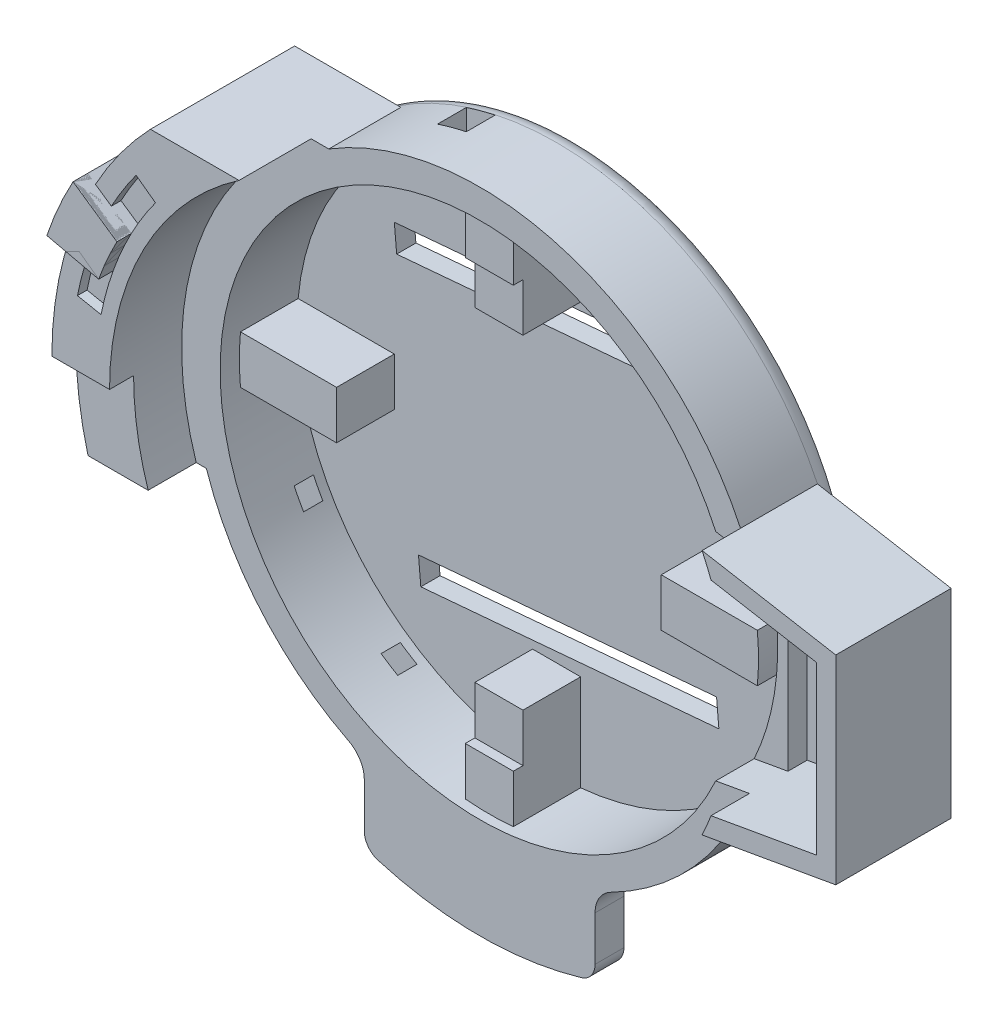
from build123d import *

# Parameters (mm, degrees)
SKETCH_1_R           = 30
EXTRUDE_1_DEPTH      = 2
SKETCH_5_R           = 30
SKETCH_5_R_2         = 27
EXTRUDE_2_DEPTH      = 10
EXTRUDE_START        = -3
EXTRUDE_3_DEPTH      = 3
FILLET_2_R           = 3
FILLET_3_R           = 3
EXTRUDE_START_2      = -6
EXTRUDE_4_DEPTH      = 6
EXTRUDE_6_DEPTH      = 7.5
SKETCH_14_R          = 31
CUT_EXTRUDE_3_DEPTH  = 7.5
CHAMFER_4_SIZE       = 2.644904711
CHAMFER_4_SIZE_2     = 15
CHAMFER_5_SIZE       = 2.644904711
CHAMFER_5_SIZE_2     = 15
CUT_EXTRUDE_START    = -4
CUT_EXTRUDE_6_DEPTH  = 4
EXTRUDE_10_DEPTH     = 5
CUT_EXTRUDE_START_2  = 6
CUT_EXTRUDE_7_DEPTH  = 6
EXTRUDE_11_DEPTH     = 8
EXTRUDE_12_DEPTH     = 1
EXTRUDE_13_DEPTH     = 1.5
EXTRUDE_14_DEPTH     = 16.5
CUT_EXTRUDE_START_3  = -1
CUT_EXTRUDE_8_DEPTH  = 1
EXTRUDE_START_3      = 2
EXTRUDE_15_DEPTH     = 2
CUT_EXTRUDE_9_DEPTH  = 2
SKETCH_33_R          = 30
CUT_EXTRUDE_10_DEPTH = 2
SKETCH_34_R          = 30
EXTRUDE_16_DEPTH     = 2
FILLET_4_R           = 2
FILLET_5_R           = 2
CUT_EXTRUDE_11_DEPTH = 10
FILLET_6_R           = 2
SKETCH_37_W          = 2
SKETCH_37_H          = 2
CUT_EXTRUDE_12_DEPTH = 65
SKETCH_38_W          = 3
SKETCH_38_H          = 3
CUT_EXTRUDE_14_DEPTH = 45
EXTRUDE_17_DEPTH     = 4


# Some blends are built 0.0001 mm under size
with BuildPart() as part:
    # 草图1 → 凸台-拉伸1 (new body)
    with BuildSketch(Plane.XY):
        Circle(SKETCH_1_R)
    extrude(amount=EXTRUDE_1_DEPTH)

    # 草图5 → 凸台-拉伸2 (add)
    with BuildSketch(Plane.XY.offset(2)):
        Circle(SKETCH_5_R)
        Circle(SKETCH_5_R_2, mode=Mode.SUBTRACT)
    extrude(amount=EXTRUDE_2_DEPTH)

    # 草图6 → 凸台-拉伸3 (add)
    with BuildSketch(Plane.XY.offset(12).offset(EXTRUDE_START)):
        with BuildLine():
            Line((-12, -27.49545417), (-12, -35.49545417))
            ThreePointArc((-12, -35.49545417), (0, -37.469017424), (12, -35.49545417))
            Line((12, -35.49545417), (12, -27.49545417))
            ThreePointArc((12, -27.49545417), (0, -30), (-12, -27.49545417))
        make_face()
    extrude(amount=EXTRUDE_3_DEPTH)

    # 圆角2
    fillet_2_edges = [part.edges().sort_by_distance(p)[0] for p in [
        (-12, -27.49545417, 10.5),
    ]]
    fillet(fillet_2_edges, radius=FILLET_2_R)

    # 圆角3
    fillet_3_edges = [part.edges().sort_by_distance(p)[0] for p in [
        (12, -27.49545417, 10.5),
    ]]
    fillet(fillet_3_edges, radius=FILLET_3_R)

    # 草图8 → 凸台-拉伸4 (add)
    with BuildSketch(Plane.XY.offset(12).offset(EXTRUDE_START_2)):
        with BuildLine():
            Line((27.037011669, -13), (41.037011669, -13))
            Line((41.037011669, -13), (41.037011669, 13))
            Line((41.037011669, 13), (27.037011669, 13))
            ThreePointArc((27.037011669, 13), (30, 0), (27.037011669, -13))
        make_face()
    extrude(amount=EXTRUDE_4_DEPTH)

    # 草图13 → 凸台-拉伸6 (add, symmetric)
    with BuildSketch(Plane.XY.offset(12)):
        with BuildLine():
            Line((-26.746575291, 25.566006927), (-15.696473801, 25.566006927))
            ThreePointArc((-15.696473801, 25.566006927), (-26.181044804, 14.647624141), (-30, 0))
            Line((-30, 0), (-37, 0))
            ThreePointArc((-37, 0), (-34.341107188, 13.772739637), (-26.746575291, 25.566006927))
        make_face()
    extrude(amount=EXTRUDE_6_DEPTH, both=True)

    # 草图14 → 切除-拉伸3 (cut)
    with BuildSketch(Plane.XY.offset(19.5)):
        Circle(SKETCH_14_R)
    extrude(amount=-CUT_EXTRUDE_3_DEPTH, mode=Mode.SUBTRACT)

    # 倒角4
    # the kernel refuses this chamfer: 15, 2.644904711 mm, written as the material it takes off along each edge
    with BuildSketch(Plane(origin=(41.037011669, 13, -32.978081946), x_dir=(0.21013876076743002, -0.9776715712462589, 0), z_dir=(0, 0, 1))) as chamfer_4_piece_1_section:
        Polygon((CHAMFER_4_SIZE * 0.977671571108, -CHAMFER_4_SIZE * 0.210138760738), (-CHAMFER_4_SIZE_2 * 0.210138760767, -CHAMFER_4_SIZE_2 * 0.977671571246), (0, 0), align=None)
    chamfer_4_piece_1 = extrude(amount=83.956163893, mode=Mode.PRIVATE)
    chamfer_4_piece_1 = chamfer_4_piece_1 - Plane(origin=(0, 0, 9), x_dir=(1, 0, 0), z_dir=(0, 0, -1)) * Cylinder(30, 227, mode=Mode.PRIVATE)
    add(chamfer_4_piece_1, mode=Mode.SUBTRACT)

    # 倒角5
    # the kernel refuses this chamfer: 15, 2.644904711 mm, written as the material it takes off along each edge
    with BuildSketch(Plane(origin=(41.037011669, -13, -32.978081946), x_dir=(0.21013876076743015, 0.9776715712462588, 0), z_dir=(0, 0, 1))) as chamfer_5_piece_1_section:
        Polygon((CHAMFER_5_SIZE * 0.977671571108, CHAMFER_5_SIZE * 0.210138760738), (-CHAMFER_5_SIZE_2 * 0.210138760767, CHAMFER_5_SIZE_2 * 0.977671571246), (0, 0), align=None)
    chamfer_5_piece_1 = extrude(amount=83.956163893, mode=Mode.PRIVATE)
    chamfer_5_piece_1 = chamfer_5_piece_1 - Plane(origin=(0, 0, 9), x_dir=(1, 0, 0), z_dir=(0, 0, -1)) * Cylinder(30, 227, mode=Mode.PRIVATE)
    add(chamfer_5_piece_1, mode=Mode.SUBTRACT)

    # 草图16 → 切除-拉伸6 (cut)
    with BuildSketch(Plane.XY.offset(12).offset(CUT_EXTRUDE_START)):
        with BuildLine():
            ThreePointArc((27, 0), (26.381265258, 5.747072595), (24.553419007, 11.230744191))
            Line((24.553419007, 11.230744191), (18.452318659, 12.306532794))
            Line((18.452318659, 12.306532794), (21.994315515, -11.681983183))
            Line((21.994315515, -11.681983183), (24.553419007, -11.230744191))
            ThreePointArc((24.553419007, -11.230744191), (26.381265258, -5.747072595), (27, 0))
        make_face()
        with BuildLine():
            Line((18.452318659, 12.306532794), (24.553419007, 11.230744191))
            ThreePointArc((24.553419007, 11.230744191), (-27, 0), (24.553419007, -11.230744191))
            Line((24.553419007, -11.230744191), (21.994315515, -11.681983183))
            Line((21.994315515, -11.681983183), (18.452318659, 12.306532794))
        make_face()
        with BuildLine():
            Line((39.037011669, 8.676896027), (27.995789134, 10.62376146))
            Line((27.995789134, 10.62376146), (24.553419007, 11.230744191))
            ThreePointArc((24.553419007, 11.230744191), (26.381265258, 5.747072595), (27, 0))
            ThreePointArc((27, 0), (26.381265258, -5.747072595), (24.553419007, -11.230744191))
            Line((24.553419007, -11.230744191), (39.037011669, -8.676896027))
            Line((39.037011669, -8.676896027), (39.037011669, 8.676896027))
        make_face()
    extrude(amount=CUT_EXTRUDE_6_DEPTH, mode=Mode.SUBTRACT)

    # 草图17 → 凸台-拉伸10 (add, symmetric)
    with BuildSketch(Plane.XY.offset(12)):
        with BuildLine():
            Line((-28.430518618, -9.576304669), (-35.739255573, -9.576304669))
            ThreePointArc((-35.739255573, -9.576304669), (-36.683459871, -4.829469112), (-37, 0))
            Line((-37, 0), (-31, 0))
            Line((-31, 0), (-30, 0))
            ThreePointArc((-30, 0), (-29.605029628, -4.852032639), (-28.430518618, -9.576304669))
        make_face()
    extrude(amount=EXTRUDE_10_DEPTH, both=True)

    # 草图18 → 切除-拉伸7 (cut)
    with BuildSketch(Plane.XY.offset(12).offset(CUT_EXTRUDE_START_2)):
        with BuildLine():
            ThreePointArc((-31, 0), (-30.618603506, -4.847795306), (-29.483798753, -9.576304669))
            Line((-29.483798753, -9.576304669), (-28.430518618, -9.576304669))
            ThreePointArc((-28.430518618, -9.576304669), (-29.605029628, -4.852032639), (-30, 0))
            Line((-30, 0), (-31, 0))
        make_face()
    extrude(amount=-CUT_EXTRUDE_7_DEPTH, mode=Mode.SUBTRACT)

    # 草图19 → 凸台-拉伸11 (add)
    with BuildSketch(Plane.XY.offset(2)):
        with BuildLine():
            Line((-2.5, 26.884010118), (-2.5, 16.884010118))
            Line((-2.5, 16.884010118), (2.5, 16.884010118))
            Line((2.5, 16.884010118), (2.5, 26.884010118))
            ThreePointArc((2.5, 26.884010118), (0, 27), (-2.5, 26.884010118))
        make_face()
        with BuildLine():
            Line((26.884010118, 2.5), (16.884010118, 2.5))
            Line((16.884010118, 2.5), (16.884010118, -2.5))
            Line((16.884010118, -2.5), (26.884010118, -2.5))
            ThreePointArc((26.884010118, -2.5), (27, 0), (26.884010118, 2.5))
        make_face()
        with BuildLine():
            Line((2.5, -26.884010118), (2.5, -16.884010118))
            Line((2.5, -16.884010118), (-2.5, -16.884010118))
            Line((-2.5, -16.884010118), (-2.5, -26.884010118))
            ThreePointArc((-2.5, -26.884010118), (0, -27), (2.5, -26.884010118))
        make_face()
        with BuildLine():
            Line((-26.884010118, -2.5), (-16.884010118, -2.5))
            Line((-16.884010118, -2.5), (-16.884010118, 2.5))
            Line((-16.884010118, 2.5), (-26.884010118, 2.5))
            ThreePointArc((-26.884010118, 2.5), (-27, 0), (-26.884010118, -2.5))
        make_face()
    extrude(amount=EXTRUDE_11_DEPTH)

    # 草图20 → 凸台-拉伸12 (add)
    with BuildSketch(Plane.XY.offset(10)):
        with BuildLine():
            ThreePointArc((2.5, -26.884010118), (0, -27), (-2.5, -26.884010118))
            Line((-2.5, -26.884010118), (-2.5, -21.884010118))
            Line((-2.5, -21.884010118), (2.5, -21.884010118))
            Line((2.5, -21.884010118), (2.5, -26.884010118))
        make_face()
        with BuildLine():
            ThreePointArc((2.5, 26.884010118), (0, 27), (-2.5, 26.884010118))
            Line((-2.5, 26.884010118), (-2.5, 21.884010118))
            Line((-2.5, 21.884010118), (2.5, 21.884010118))
            Line((2.5, 21.884010118), (2.5, 26.884010118))
        make_face()
    extrude(amount=EXTRUDE_12_DEPTH)

    # 草图21 → 凸台-拉伸13 (add)
    with BuildSketch(Plane.XY.offset(19.5)):
        with BuildLine():
            Line((-28.734434843, 15.184935109), (-33.295866493, 18.31352709))
            ThreePointArc((-33.295866493, 18.31352709), (-34.796265088, 15.271540063), (-36.019428995, 12.10787904))
            Line((-36.019428995, 12.10787904), (-30.628781703, 10.868658214))
            ThreePointArc((-30.628781703, 10.868658214), (-29.759963562, 13.061185581), (-28.734434843, 15.184935109))
        make_face()
    extrude(amount=EXTRUDE_13_DEPTH)

    # 草图28 → 切除-拉伸8 (cut)
    with BuildSketch(Plane.XY.offset(19.5).offset(CUT_EXTRUDE_START_3)):
        with BuildLine():
            Line((-34.336052546, 6.784946244), (-31.883477364, 6.300307226))
            ThreePointArc((-31.883477364, 6.300307226), (-31.339481347, 8.60737526), (-30.628781703, 10.868658214))
            Line((-30.628781703, 10.868658214), (-33.080272788, 11.432215546))
            ThreePointArc((-33.080272788, 11.432215546), (-33.788156333, 9.130196691), (-34.336052546, 6.784946244))
        make_face()
        with BuildLine():
            ThreePointArc((-28.734434843, 15.184935109), (-27.551258788, 17.238855508), (-26.22152974, 19.201077524))
            Line((-26.22152974, 19.201077524), (-28.23857049, 20.678083487))
            ThreePointArc((-28.23857049, 20.678083487), (-29.593761465, 18.687142166), (-30.80882562, 16.607717))
            Line((-30.80882562, 16.607717), (-28.734434843, 15.184935109))
        make_face()
    extrude(amount=CUT_EXTRUDE_8_DEPTH, mode=Mode.SUBTRACT)

    # 草图31 → 凸台-拉伸15 (add)
    with BuildSketch(Plane(origin=(0, 0, 6), x_dir=(-1, 0, 0), z_dir=(0, 0, -1)).offset(EXTRUDE_START_3)):
        with BuildLine():
            Line((-41.037011669, 10.355095289), (-41.037011669, -10.355095289))
            Line((-41.037011669, -10.355095289), (-27.128728731, -12.807500827))
            ThreePointArc((-27.128728731, -12.807500827), (-30, 0), (-27.128728731, 12.807500827))
            Line((-27.128728731, 12.807500827), (-41.037011669, 10.355095289))
        make_face()
    extrude(amount=-EXTRUDE_15_DEPTH)

    # 草图32 → 切除-拉伸9 (cut)
    with BuildSketch(Plane.XY.offset(8)):
        Polygon((39.037011669, -8.676896027), (28.060239243, -10.612397167), (28.060239243, 10.612397167), (39.037011669, 8.676896027), align=None)
    extrude(amount=-CUT_EXTRUDE_9_DEPTH, mode=Mode.SUBTRACT)

    # 草图33 → 切除-拉伸10 (cut)
    with BuildSketch(Plane(origin=(0, 0, 0), x_dir=(-1, 0, 0), z_dir=(0, 0, -1))):
        Circle(SKETCH_33_R)
    extrude(amount=-CUT_EXTRUDE_10_DEPTH, mode=Mode.SUBTRACT)

    # 草图34 → 凸台-拉伸16 (add)
    with BuildSketch(Plane(origin=(0, 0, 2), x_dir=(-1, 0, 0), z_dir=(0, 0, -1))):
        Circle(SKETCH_34_R)
    extrude(amount=-EXTRUDE_16_DEPTH)

    # 圆角4
    fillet_4_edges = [part.edges().sort_by_distance(p)[0] for p in [
        (-12, -35.49545417, 10.5),
    ]]
    fillet(fillet_4_edges, radius=FILLET_4_R)

    # 圆角5
    fillet_5_edges = [part.edges().sort_by_distance(p)[0] for p in [
        (12, -35.49545417, 10.5),
    ]]
    fillet(fillet_5_edges, radius=FILLET_5_R)

    # 草图35 → 切除-拉伸11 (cut)
    with BuildSketch(Plane.XY.offset(4)):
        Polygon((-16.877298883, 14.375665163), (14.124586731, 17.087978702), (14.365382137, 14.33567462), (-16.636503477, 11.623361081), align=None)
        Polygon((16.877298883, -14.375665163), (16.636503477, -11.623361081), (-14.365382137, -14.33567462), (-14.124586731, -17.087978702), align=None)
    extrude(amount=-CUT_EXTRUDE_11_DEPTH, mode=Mode.SUBTRACT)

    # 圆角6
    fillet_6_edges = [part.edges().sort_by_distance(p)[0] for p in [
        (-30, 0, 2),
    ]]
    fillet(fillet_6_edges, radius=FILLET_6_R - 0.0001)  # a hair under: the kernel refuses the full size

    # 草图37 → 切除-拉伸12 (cut)
    with BuildSketch(Plane(origin=(7.192005059, 7.192005059, 0), x_dir=(0, 0, 1), z_dir=(-0.7071067811865475, -0.7071067811865476, 0))):
        with Locations((5.93438389, 7.985973932)):
            Rectangle(SKETCH_37_W, SKETCH_37_H)
        with Locations((5.93438389, -5.888371601)):
            Rectangle(SKETCH_37_W, SKETCH_37_H)
    extrude(amount=CUT_EXTRUDE_12_DEPTH, mode=Mode.SUBTRACT)

    # 草图38 → 切除-拉伸14 (cut)
    with BuildSketch(Plane(origin=(0, 0, 0), x_dir=(1, 0, 0), z_dir=(0, 1, 0))):
        with Locations((-7.837080141, -5.551868465)):
            Rectangle(SKETCH_38_W, SKETCH_38_H)
    extrude(amount=CUT_EXTRUDE_14_DEPTH, mode=Mode.SUBTRACT)

    # 草图40 → 凸台-拉伸17 (add)
    with BuildSketch(Plane.XY.offset(12)):
        with BuildLine():
            Line((27.128728731, -12.807500827), (41.037011669, -10.355095289))
            Line((41.037011669, -10.355095289), (41.037011669, 10.355095289))
            Line((41.037011669, 10.355095289), (27.128728731, 12.807500827))
            ThreePointArc((27.128728731, 12.807500827), (27.61630255, 11.719207886), (28.060239243, 10.612397167))
            Line((28.060239243, 10.612397167), (39.037011669, 8.676896027))
            Line((39.037011669, 8.676896027), (39.037011669, -8.676896027))
            Line((39.037011669, -8.676896027), (28.060239243, -10.612397167))
            ThreePointArc((28.060239243, -10.612397167), (27.61630255, -11.719207886), (27.128728731, -12.807500827))
        make_face()
    extrude(amount=EXTRUDE_17_DEPTH)


with BuildPart() as body_2:
    # 草图26 → 凸台-拉伸14 (new body)
    with BuildSketch(Plane.XY.offset(21)):
        with BuildLine():
            Line((-28.734434843, 15.184935109), (-33.295866493, 18.31352709))
            ThreePointArc((-33.295866493, 18.31352709), (-34.796265088, 15.271540063), (-36.019428995, 12.10787904))
            Line((-36.019428995, 12.10787904), (-30.628781703, 10.868658214))
            ThreePointArc((-30.628781703, 10.868658214), (-29.759963562, 13.061185581), (-28.734434843, 15.184935109))
        make_face()
    extrude(amount=-EXTRUDE_14_DEPTH)


solid = Compound([part.part, body_2.part])
